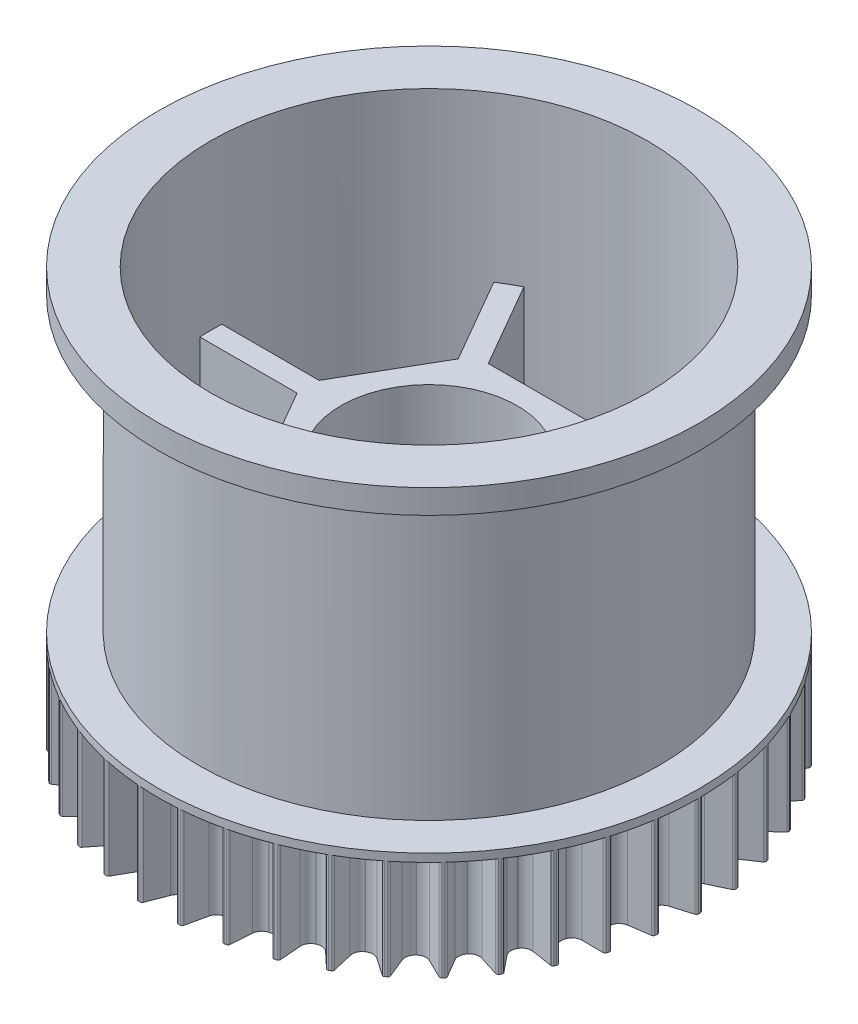
from build123d import *

# Parameters (mm, degrees)
SKETCH_1_R          = 4.4
EXTRUDE_1_DEPTH     = 5
SKETCH_2_R          = 13.5
SKETCH_2_R_2        = 11.2
EXTRUDE_2_DEPTH     = 0.4
SKETCH_2_2_R        = 11.5
SKETCH_2_2_R_2      = 10.9
EXTRUDE_2_2_DEPTH   = 15
SKETCH_5_R          = 13.5
SKETCH_5_R_2        = 10.9
EXTRUDE_3_DEPTH     = 1.2
SKETCH_6_R          = 4.4
EXTRUDE_4_DEPTH     = 8
SKETCH_1_6_R        = 4.4
SKETCH_1_6_R_2      = 3.5
EXTRUDE_5_DEPTH     = 13
SKETCH_1_7_R        = 4.4
SKETCH_1_7_R_2      = 3.5
CUT_EXTRUDE_1_DEPTH = 3
CUT_EXTRUDE_START   = -3
SKETCH_8_R          = 4.4
SKETCH_8_R_2        = 3.5
CUT_EXTRUDE_2_DEPTH = 3


with BuildPart() as part:
    # 草图1 → 凸台-拉伸1 (new body)
    with BuildSketch(Plane(origin=(0, 0, 0), x_dir=(1, 0, 0), z_dir=(0, 1, 0))):
        with BuildLine():
            Line((12.421648835, 0.449416948), (13.428727986, 0.146279171))
            ThreePointArc((13.428727986, 0.146279171), (13.480048996, 0.110330314), (13.499904043, 0.050900158))
            ThreePointArc((13.499904043, 0.050900158), (13.5, 0), (13.499904043, -0.050900158))
            ThreePointArc((13.499904043, -0.050900158), (13.480048996, -0.110330314), (13.428727986, -0.146279171))
            Line((13.428727986, -0.146279171), (12.421648835, -0.449416948))
            ThreePointArc((12.421648835, -0.449416948), (12.175747513, -0.615329239), (12.067123529, -0.89136398))
            ThreePointArc((12.067123529, -0.89136398), (12.066165946, -0.904234132), (12.065194637, -0.917103256))
            ThreePointArc((12.065194637, -0.917103256), (12.131464538, -1.206244482), (12.349891401, -1.40695336))
            Line((12.349891401, -1.40695336), (13.300541969, -1.856802698))
            ThreePointArc((13.300541969, -1.856802698), (13.345931866, -1.899999035), (13.356707544, -1.961724646))
            ThreePointArc((13.356707544, -1.961724646), (13.349216154, -2.012070593), (13.341534994, -2.062387937))
            ThreePointArc((13.341534994, -2.062387937), (13.313044106, -2.118195066), (13.256938411, -2.146093404))
            Line((13.256938411, -2.146093404), (12.21592716, -2.295748024))
            ThreePointArc((12.21592716, -2.295748024), (11.948044409, -2.423157522), (11.799492821, -2.679919618))
            ThreePointArc((11.799492821, -2.679919618), (11.796627737, -2.692503301), (11.793749233, -2.705083921))
            ThreePointArc((11.793749233, -2.705083921), (11.816184691, -3.000872694), (12.0022578, -3.231894655))
            Line((12.0022578, -3.231894655), (12.875243823, -3.818406662))
            ThreePointArc((12.875243823, -3.818406662), (12.913688672, -3.867885545), (12.915144269, -3.930527764))
            ThreePointArc((12.915144269, -3.930527764), (12.900232878, -3.979194855), (12.885138099, -4.027805378))
            ThreePointArc((12.885138099, -4.027805378), (12.84864781, -4.07874284), (12.789010738, -4.097967457))
            Line((12.789010738, -4.097967457), (11.737321858, -4.090795883))
            ThreePointArc((11.737321858, -4.090795883), (11.453441736, -4.176856469), (11.268280943, -4.40861028))
            ThreePointArc((11.268280943, -4.40861028), (11.263572359, -4.420626395), (11.258850961, -4.432637481))
            ThreePointArc((11.258850961, -4.432637481), (11.236950804, -4.72846637), (11.386513594, -4.984640763))
            Line((11.386513594, -4.984640763), (12.162334005, -5.694713732))
            ThreePointArc((12.162334005, -5.694713732), (12.192975012, -5.749369884), (12.185078013, -5.811529386))
            ThreePointArc((12.185078013, -5.811529386), (12.163079717, -5.857430478), (12.140908512, -5.903248302))
            ThreePointArc((12.140908512, -5.903248302), (12.097233954, -5.94817824), (12.035397698, -5.958299689))
            Line((12.035397698, -5.958299689), (10.996524182, -5.794462121))
            ThreePointArc((10.996524182, -5.794462121), (10.702988102, -5.837251346), (10.485354288, -6.038819873))
            ThreePointArc((10.485354288, -6.038819873), (10.478907386, -6.05), (10.472448563, -6.061173244))
            ThreePointArc((10.472448563, -6.061173244), (10.406702004, -6.35043392), (10.51641349, -6.626038234))
            Line((10.51641349, -6.626038234), (11.177737743, -7.443810306))
            ThreePointArc((11.177737743, -7.443810306), (11.199890439, -7.5024228), (11.18281725, -7.562711045))
            ThreePointArc((11.18281725, -7.562711045), (11.154223453, -7.604820784), (11.12547109, -7.646822414))
            ThreePointArc((11.12547109, -7.646822414), (11.075587881, -7.684741166), (11.012933761, -7.685533352))
            Line((11.012933761, -7.685533352), (10.010082327, -7.368689651))
            ThreePointArc((10.010082327, -7.368689651), (9.713447399, -7.367251672), (9.468202145, -7.534132209))
            ThreePointArc((9.468202145, -7.534132209), (9.460160938, -7.544226602), (9.452108969, -7.554312413))
            ThreePointArc((9.452108969, -7.554312413), (9.343984679, -7.83054327), (9.411394086, -8.11942096))
            Line((9.411394086, -8.11942096), (9.943449291, -9.026624459))
            ThreePointArc((9.943449291, -9.026624459), (9.956618821, -9.087883988), (9.930750828, -9.144954237))
            ThreePointArc((9.930750828, -9.144954237), (9.89620027, -9.18233196), (9.861509029, -9.219579149))
            ThreePointArc((9.861509029, -9.219579149), (9.806531477, -9.249639674), (9.744459083, -9.241084899))
            Line((9.744459083, -9.241084899), (8.800031773, -8.778312831))
            ThreePointArc((8.800031773, -8.778312831), (8.506924332, -8.732679771), (8.239546012, -8.861144482))
            ThreePointArc((8.239546012, -8.861144482), (8.230090127, -8.869927649), (8.22062488, -8.878700726))
            ThreePointArc((8.22062488, -8.878700726), (8.072538176, -9.135731223), (8.09613969, -9.431429239))
            Line((8.09613969, -9.431429239), (8.487040612, -10.407798738))
            ThreePointArc((8.487040612, -10.407798738), (8.49093279, -10.470336865), (8.456847843, -10.522914262))
            ThreePointArc((8.456847843, -10.522914262), (8.417112325, -10.554725013), (8.377257151, -10.586385721))
            ThreePointArc((8.377257151, -10.586385721), (8.318413365, -10.607916516), (8.258309291, -10.59020588))
            Line((8.258309291, -10.59020588), (7.393403052, -9.991843007))
            ThreePointArc((7.393403052, -9.991843007), (7.110370633, -9.903034234), (6.826832036, -9.990213429))
            ThreePointArc((6.826832036, -9.990213429), (6.816172703, -9.997489169), (6.805505615, -10.004753536))
            ThreePointArc((6.805505615, -10.004753536), (6.620764509, -10.236842037), (6.600030911, -10.532754974))
            Line((6.600030911, -10.532754974), (6.841045471, -11.556479991))
            ThreePointArc((6.841045471, -11.556479991), (6.835573353, -11.618899718), (6.794032851, -11.665809771))
            ThreePointArc((6.794032851, -11.665809771), (6.75, -11.691342951), (6.705871192, -11.716709929))
            ThreePointArc((6.705871192, -11.716709929), (6.644475643, -11.729230032), (6.587682515, -11.702759162))
            Line((6.587682515, -11.702759162), (5.821617923, -10.982171922))
            ThreePointArc((5.821617923, -10.982171922), (5.554983004, -10.852171276), (5.261617913, -10.896117516))
            ThreePointArc((5.261617913, -10.896117516), (5.249993243, -10.901723302), (5.238362601, -10.907316685))
            ThreePointArc((5.238362601, -10.907316685), (5.021093904, -11.109278715), (4.956488349, -11.398796367))
            Line((4.956488349, -11.398796367), (5.042232678, -12.447008578))
            ThreePointArc((5.042232678, -12.447008578), (5.027518502, -12.507915551), (4.979450393, -12.548110367))
            ThreePointArc((4.979450393, -12.548110367), (4.932103829, -12.566795607), (4.884687151, -12.585302199))
            ThreePointArc((4.884687151, -12.585302199), (4.822111316, -12.588531931), (4.769897799, -12.553892142))
            Line((4.769897799, -12.553892142), (4.11978747, -11.727177263))
            ThreePointArc((4.11978747, -11.727177263), (3.875506233, -11.558888745), (3.578867941, -11.558620344))
            ThreePointArc((3.578867941, -11.558620344), (3.56653761, -11.56243095), (3.554203222, -11.566228402))
            ThreePointArc((3.554203222, -11.566228402), (3.309260359, -11.733552465), (3.202226027, -12.010207485))
            Line((3.202226027, -12.010207485), (3.13078474, -13.059491561))
            ThreePointArc((3.13078474, -13.059491561), (3.107157195, -13.117525219), (3.053635241, -13.150106913))
            ThreePointArc((3.053635241, -13.150106913), (3.004032608, -13.161526814), (2.954387271, -13.172759614))
            ThreePointArc((2.954387271, -13.172759614), (2.89202899, -13.166626828), (2.845561447, -13.124591917))
            Line((2.845561447, -13.124591917), (2.325927773, -12.210216843))
            ThreePointArc((2.325927773, -12.210216843), (2.109457058, -12.007399739), (1.816171974, -11.962922693))
            ThreePointArc((1.816171974, -11.962922693), (1.803411421, -11.964852997), (1.790648816, -11.96676969))
            ThreePointArc((1.790648816, -11.96676969), (1.523503405, -12.095718042), (1.376431267, -12.353330415))
            Line((1.376431267, -12.353330415), (1.149400244, -13.380247083))
            ThreePointArc((1.149400244, -13.380247083), (1.117387131, -13.43411105), (1.059606923, -13.4583518))
            ThreePointArc((1.059606923, -13.4583518), (1.008856263, -13.462251262), (0.958091262, -13.465959347))
            ThreePointArc((0.958091262, -13.465959347), (0.897343515, -13.45060104), (0.857659955, -13.402109995))
            Line((0.857659955, -13.402109995), (0.480110693, -12.420500356))
            ThreePointArc((0.480110693, -12.420500356), (0.296286097, -12.187685265), (0.012905725, -12.099993117))
            ThreePointArc((0.012905725, -12.099993117), (0, -12.1), (-0.012905725, -12.099993117))
            ThreePointArc((-0.012905725, -12.099993117), (-0.296286097, -12.187685265), (-0.480110693, -12.420500356))
            Line((-0.480110693, -12.420500356), (-0.857659955, -13.402109995))
            ThreePointArc((-0.857659955, -13.402109995), (-0.897343515, -13.45060104), (-0.958091262, -13.465959347))
            ThreePointArc((-0.958091262, -13.465959347), (-1.008856263, -13.462251262), (-1.059606923, -13.4583518))
            ThreePointArc((-1.059606923, -13.4583518), (-1.117387131, -13.43411105), (-1.149400244, -13.380247083))
            Line((-1.149400244, -13.380247083), (-1.376431267, -12.353330415))
            ThreePointArc((-1.376431267, -12.353330415), (-1.523503405, -12.095718042), (-1.790648816, -11.96676969))
            ThreePointArc((-1.790648816, -11.96676969), (-1.803411421, -11.964852997), (-1.816171974, -11.962922693))
            ThreePointArc((-1.816171974, -11.962922693), (-2.109457058, -12.007399739), (-2.325927773, -12.210216843))
            Line((-2.325927773, -12.210216843), (-2.845561447, -13.124591917))
            ThreePointArc((-2.845561447, -13.124591917), (-2.89202899, -13.166626828), (-2.954387271, -13.172759614))
            ThreePointArc((-2.954387271, -13.172759614), (-3.004032608, -13.161526814), (-3.053635241, -13.150106913))
            ThreePointArc((-3.053635241, -13.150106913), (-3.107157195, -13.117525219), (-3.13078474, -13.059491561))
            Line((-3.13078474, -13.059491561), (-3.202226027, -12.010207485))
            ThreePointArc((-3.202226027, -12.010207485), (-3.309260359, -11.733552465), (-3.554203222, -11.566228402))
            ThreePointArc((-3.554203222, -11.566228402), (-3.56653761, -11.56243095), (-3.578867941, -11.558620344))
            ThreePointArc((-3.578867941, -11.558620344), (-3.875506233, -11.558888745), (-4.11978747, -11.727177263))
            Line((-4.11978747, -11.727177263), (-4.769897799, -12.553892142))
            ThreePointArc((-4.769897799, -12.553892142), (-4.822111316, -12.588531931), (-4.884687151, -12.585302199))
            ThreePointArc((-4.884687151, -12.585302199), (-4.932103829, -12.566795607), (-4.979450393, -12.548110367))
            ThreePointArc((-4.979450393, -12.548110367), (-5.027518502, -12.507915551), (-5.042232678, -12.447008578))
            Line((-5.042232678, -12.447008578), (-4.956488349, -11.398796367))
            ThreePointArc((-4.956488349, -11.398796367), (-5.021093904, -11.109278715), (-5.238362601, -10.907316685))
            ThreePointArc((-5.238362601, -10.907316685), (-5.249993243, -10.901723302), (-5.261617913, -10.896117516))
            ThreePointArc((-5.261617913, -10.896117516), (-5.554983004, -10.852171276), (-5.821617923, -10.982171922))
            Line((-5.821617923, -10.982171922), (-6.587682515, -11.702759162))
            ThreePointArc((-6.587682515, -11.702759162), (-6.644475643, -11.729230032), (-6.705871192, -11.716709929))
            ThreePointArc((-6.705871192, -11.716709929), (-6.75, -11.691342951), (-6.794032851, -11.665809771))
            ThreePointArc((-6.794032851, -11.665809771), (-6.835573353, -11.618899718), (-6.841045471, -11.556479991))
            Line((-6.841045471, -11.556479991), (-6.600030911, -10.532754974))
            ThreePointArc((-6.600030911, -10.532754974), (-6.620764509, -10.236842037), (-6.805505615, -10.004753536))
            ThreePointArc((-6.805505615, -10.004753536), (-6.816172703, -9.997489169), (-6.826832036, -9.990213429))
            ThreePointArc((-6.826832036, -9.990213429), (-7.110370633, -9.903034234), (-7.393403052, -9.991843007))
            Line((-7.393403052, -9.991843007), (-8.258309291, -10.59020588))
            ThreePointArc((-8.258309291, -10.59020588), (-8.318413365, -10.607916516), (-8.377257151, -10.586385721))
            ThreePointArc((-8.377257151, -10.586385721), (-8.417112325, -10.554725013), (-8.456847843, -10.522914262))
            ThreePointArc((-8.456847843, -10.522914262), (-8.49093279, -10.470336865), (-8.487040612, -10.407798738))
            Line((-8.487040612, -10.407798738), (-8.09613969, -9.431429239))
            ThreePointArc((-8.09613969, -9.431429239), (-8.072538176, -9.135731223), (-8.22062488, -8.878700726))
            ThreePointArc((-8.22062488, -8.878700726), (-8.230090127, -8.869927649), (-8.239546012, -8.861144482))
            ThreePointArc((-8.239546012, -8.861144482), (-8.506924332, -8.732679771), (-8.800031773, -8.778312831))
            Line((-8.800031773, -8.778312831), (-9.744459083, -9.241084899))
            ThreePointArc((-9.744459083, -9.241084899), (-9.806531477, -9.249639674), (-9.861509029, -9.219579149))
            ThreePointArc((-9.861509029, -9.219579149), (-9.89620027, -9.18233196), (-9.930750828, -9.144954237))
            ThreePointArc((-9.930750828, -9.144954237), (-9.956618821, -9.087883988), (-9.943449291, -9.026624459))
            Line((-9.943449291, -9.026624459), (-9.411394086, -8.11942096))
            ThreePointArc((-9.411394086, -8.11942096), (-9.343984679, -7.83054327), (-9.452108969, -7.554312413))
            ThreePointArc((-9.452108969, -7.554312413), (-9.460160938, -7.544226602), (-9.468202145, -7.534132209))
            ThreePointArc((-9.468202145, -7.534132209), (-9.713447399, -7.367251672), (-10.010082327, -7.368689651))
            Line((-10.010082327, -7.368689651), (-11.012933761, -7.685533352))
            ThreePointArc((-11.012933761, -7.685533352), (-11.075587881, -7.684741166), (-11.12547109, -7.646822414))
            ThreePointArc((-11.12547109, -7.646822414), (-11.154223453, -7.604820784), (-11.18281725, -7.562711045))
            ThreePointArc((-11.18281725, -7.562711045), (-11.199890439, -7.5024228), (-11.177737743, -7.443810306))
            Line((-11.177737743, -7.443810306), (-10.51641349, -6.626038234))
            ThreePointArc((-10.51641349, -6.626038234), (-10.406702004, -6.35043392), (-10.472448563, -6.061173244))
            ThreePointArc((-10.472448563, -6.061173244), (-10.478907386, -6.05), (-10.485354288, -6.038819873))
            ThreePointArc((-10.485354288, -6.038819873), (-10.702988102, -5.837251346), (-10.996524182, -5.794462121))
            Line((-10.996524182, -5.794462121), (-12.035397698, -5.958299689))
            ThreePointArc((-12.035397698, -5.958299689), (-12.097233954, -5.94817824), (-12.140908512, -5.903248302))
            ThreePointArc((-12.140908512, -5.903248302), (-12.163079717, -5.857430478), (-12.185078013, -5.811529386))
            ThreePointArc((-12.185078013, -5.811529386), (-12.192975012, -5.749369884), (-12.162334005, -5.694713732))
            Line((-12.162334005, -5.694713732), (-11.386513594, -4.984640763))
            ThreePointArc((-11.386513594, -4.984640763), (-11.236950804, -4.72846637), (-11.258850961, -4.432637481))
            ThreePointArc((-11.258850961, -4.432637481), (-11.263572359, -4.420626395), (-11.268280943, -4.40861028))
            ThreePointArc((-11.268280943, -4.40861028), (-11.453441736, -4.176856469), (-11.737321858, -4.090795883))
            Line((-11.737321858, -4.090795883), (-12.789010738, -4.097967457))
            ThreePointArc((-12.789010738, -4.097967457), (-12.84864781, -4.07874284), (-12.885138099, -4.027805378))
            ThreePointArc((-12.885138099, -4.027805378), (-12.900232878, -3.979194855), (-12.915144269, -3.930527764))
            ThreePointArc((-12.915144269, -3.930527764), (-12.913688672, -3.867885545), (-12.875243823, -3.818406662))
            Line((-12.875243823, -3.818406662), (-12.0022578, -3.231894655))
            ThreePointArc((-12.0022578, -3.231894655), (-11.816184691, -3.000872694), (-11.793749233, -2.705083921))
            ThreePointArc((-11.793749233, -2.705083921), (-11.796627737, -2.692503301), (-11.799492821, -2.679919618))
            ThreePointArc((-11.799492821, -2.679919618), (-11.948044409, -2.423157522), (-12.21592716, -2.295748024))
            Line((-12.21592716, -2.295748024), (-13.256938411, -2.146093404))
            ThreePointArc((-13.256938411, -2.146093404), (-13.313044106, -2.118195066), (-13.341534994, -2.062387937))
            ThreePointArc((-13.341534994, -2.062387937), (-13.349216154, -2.012070593), (-13.356707544, -1.961724646))
            ThreePointArc((-13.356707544, -1.961724646), (-13.345931866, -1.899999035), (-13.300541969, -1.856802698))
            Line((-13.300541969, -1.856802698), (-12.349891401, -1.40695336))
            ThreePointArc((-12.349891401, -1.40695336), (-12.131464538, -1.206244482), (-12.065194637, -0.917103256))
            ThreePointArc((-12.065194637, -0.917103256), (-12.066165946, -0.904234132), (-12.067123529, -0.89136398))
            ThreePointArc((-12.067123529, -0.89136398), (-12.175747513, -0.615329239), (-12.421648835, -0.449416948))
            Line((-12.421648835, -0.449416948), (-13.428727986, -0.146279171))
            ThreePointArc((-13.428727986, -0.146279171), (-13.480048996, -0.110330314), (-13.499904043, -0.050900158))
            ThreePointArc((-13.499904043, -0.050900158), (-13.5, 0), (-13.499904043, 0.050900158))
            ThreePointArc((-13.499904043, 0.050900158), (-13.480048996, 0.110330314), (-13.428727986, 0.146279171))
            Line((-13.428727986, 0.146279171), (-12.421648835, 0.449416948))
            ThreePointArc((-12.421648835, 0.449416948), (-12.175747513, 0.615329239), (-12.067123529, 0.89136398))
            ThreePointArc((-12.067123529, 0.89136398), (-12.066165946, 0.904234132), (-12.065194637, 0.917103256))
            ThreePointArc((-12.065194637, 0.917103256), (-12.131464538, 1.206244482), (-12.349891401, 1.40695336))
            Line((-12.349891401, 1.40695336), (-13.300541969, 1.856802698))
            ThreePointArc((-13.300541969, 1.856802698), (-13.345931866, 1.899999035), (-13.356707544, 1.961724646))
            ThreePointArc((-13.356707544, 1.961724646), (-13.349216154, 2.012070593), (-13.341534994, 2.062387937))
            ThreePointArc((-13.341534994, 2.062387937), (-13.313044106, 2.118195066), (-13.256938411, 2.146093404))
            Line((-13.256938411, 2.146093404), (-12.21592716, 2.295748024))
            ThreePointArc((-12.21592716, 2.295748024), (-11.948044409, 2.423157522), (-11.799492821, 2.679919618))
            ThreePointArc((-11.799492821, 2.679919618), (-11.796627737, 2.692503301), (-11.793749233, 2.705083921))
            ThreePointArc((-11.793749233, 2.705083921), (-11.816184691, 3.000872694), (-12.0022578, 3.231894655))
            Line((-12.0022578, 3.231894655), (-12.875243823, 3.818406662))
            ThreePointArc((-12.875243823, 3.818406662), (-12.913688672, 3.867885545), (-12.915144269, 3.930527764))
            ThreePointArc((-12.915144269, 3.930527764), (-12.900232878, 3.979194855), (-12.885138099, 4.027805378))
            ThreePointArc((-12.885138099, 4.027805378), (-12.84864781, 4.07874284), (-12.789010738, 4.097967457))
            Line((-12.789010738, 4.097967457), (-11.737321858, 4.090795883))
            ThreePointArc((-11.737321858, 4.090795883), (-11.453441736, 4.176856469), (-11.268280943, 4.40861028))
            ThreePointArc((-11.268280943, 4.40861028), (-11.263572359, 4.420626395), (-11.258850961, 4.432637481))
            ThreePointArc((-11.258850961, 4.432637481), (-11.236950804, 4.72846637), (-11.386513594, 4.984640763))
            Line((-11.386513594, 4.984640763), (-12.162334005, 5.694713732))
            ThreePointArc((-12.162334005, 5.694713732), (-12.192975012, 5.749369884), (-12.185078013, 5.811529386))
            ThreePointArc((-12.185078013, 5.811529386), (-12.163079717, 5.857430478), (-12.140908512, 5.903248302))
            ThreePointArc((-12.140908512, 5.903248302), (-12.097233954, 5.94817824), (-12.035397698, 5.958299689))
            Line((-12.035397698, 5.958299689), (-10.996524182, 5.794462121))
            ThreePointArc((-10.996524182, 5.794462121), (-10.702988102, 5.837251346), (-10.485354288, 6.038819873))
            ThreePointArc((-10.485354288, 6.038819873), (-10.478907386, 6.05), (-10.472448563, 6.061173244))
            ThreePointArc((-10.472448563, 6.061173244), (-10.406702004, 6.35043392), (-10.51641349, 6.626038234))
            Line((-10.51641349, 6.626038234), (-11.177737743, 7.443810306))
            ThreePointArc((-11.177737743, 7.443810306), (-11.199890439, 7.5024228), (-11.18281725, 7.562711045))
            ThreePointArc((-11.18281725, 7.562711045), (-11.154223453, 7.604820784), (-11.12547109, 7.646822414))
            ThreePointArc((-11.12547109, 7.646822414), (-11.075587881, 7.684741166), (-11.012933761, 7.685533352))
            Line((-11.012933761, 7.685533352), (-10.010082327, 7.368689651))
            ThreePointArc((-10.010082327, 7.368689651), (-9.713447399, 7.367251672), (-9.468202145, 7.534132209))
            ThreePointArc((-9.468202145, 7.534132209), (-9.460160938, 7.544226602), (-9.452108969, 7.554312413))
            ThreePointArc((-9.452108969, 7.554312413), (-9.343984679, 7.83054327), (-9.411394086, 8.11942096))
            Line((-9.411394086, 8.11942096), (-9.943449291, 9.026624459))
            ThreePointArc((-9.943449291, 9.026624459), (-9.956618821, 9.087883988), (-9.930750828, 9.144954237))
            ThreePointArc((-9.930750828, 9.144954237), (-9.89620027, 9.18233196), (-9.861509029, 9.219579149))
            ThreePointArc((-9.861509029, 9.219579149), (-9.806531477, 9.249639674), (-9.744459083, 9.241084899))
            Line((-9.744459083, 9.241084899), (-8.800031773, 8.778312831))
            ThreePointArc((-8.800031773, 8.778312831), (-8.506924332, 8.732679771), (-8.239546012, 8.861144482))
            ThreePointArc((-8.239546012, 8.861144482), (-8.230090127, 8.869927649), (-8.22062488, 8.878700726))
            ThreePointArc((-8.22062488, 8.878700726), (-8.072538176, 9.135731223), (-8.09613969, 9.431429239))
            Line((-8.09613969, 9.431429239), (-8.487040612, 10.407798738))
            ThreePointArc((-8.487040612, 10.407798738), (-8.49093279, 10.470336865), (-8.456847843, 10.522914262))
            ThreePointArc((-8.456847843, 10.522914262), (-8.417112325, 10.554725013), (-8.377257151, 10.586385721))
            ThreePointArc((-8.377257151, 10.586385721), (-8.318413365, 10.607916516), (-8.258309291, 10.59020588))
            Line((-8.258309291, 10.59020588), (-7.393403052, 9.991843007))
            ThreePointArc((-7.393403052, 9.991843007), (-7.110370633, 9.903034234), (-6.826832036, 9.990213429))
            ThreePointArc((-6.826832036, 9.990213429), (-6.816172703, 9.997489169), (-6.805505615, 10.004753536))
            ThreePointArc((-6.805505615, 10.004753536), (-6.620764509, 10.236842037), (-6.600030911, 10.532754974))
            Line((-6.600030911, 10.532754974), (-6.841045471, 11.556479991))
            ThreePointArc((-6.841045471, 11.556479991), (-6.835573353, 11.618899718), (-6.794032851, 11.665809771))
            ThreePointArc((-6.794032851, 11.665809771), (-6.75, 11.691342951), (-6.705871192, 11.716709929))
            ThreePointArc((-6.705871192, 11.716709929), (-6.644475643, 11.729230032), (-6.587682515, 11.702759162))
            Line((-6.587682515, 11.702759162), (-5.821617923, 10.982171922))
            ThreePointArc((-5.821617923, 10.982171922), (-5.554983004, 10.852171276), (-5.261617913, 10.896117516))
            ThreePointArc((-5.261617913, 10.896117516), (-5.249993243, 10.901723302), (-5.238362601, 10.907316685))
            ThreePointArc((-5.238362601, 10.907316685), (-5.021093904, 11.109278715), (-4.956488349, 11.398796367))
            Line((-4.956488349, 11.398796367), (-5.042232678, 12.447008578))
            ThreePointArc((-5.042232678, 12.447008578), (-5.027518502, 12.507915551), (-4.979450393, 12.548110367))
            ThreePointArc((-4.979450393, 12.548110367), (-4.932103829, 12.566795607), (-4.884687151, 12.585302199))
            ThreePointArc((-4.884687151, 12.585302199), (-4.822111316, 12.588531931), (-4.769897799, 12.553892142))
            Line((-4.769897799, 12.553892142), (-4.11978747, 11.727177263))
            ThreePointArc((-4.11978747, 11.727177263), (-3.875506233, 11.558888745), (-3.578867941, 11.558620344))
            ThreePointArc((-3.578867941, 11.558620344), (-3.56653761, 11.56243095), (-3.554203222, 11.566228402))
            ThreePointArc((-3.554203222, 11.566228402), (-3.309260359, 11.733552465), (-3.202226027, 12.010207485))
            Line((-3.202226027, 12.010207485), (-3.13078474, 13.059491561))
            ThreePointArc((-3.13078474, 13.059491561), (-3.107157195, 13.117525219), (-3.053635241, 13.150106913))
            ThreePointArc((-3.053635241, 13.150106913), (-3.004032608, 13.161526814), (-2.954387271, 13.172759614))
            ThreePointArc((-2.954387271, 13.172759614), (-2.89202899, 13.166626828), (-2.845561447, 13.124591917))
            Line((-2.845561447, 13.124591917), (-2.325927773, 12.210216843))
            ThreePointArc((-2.325927773, 12.210216843), (-2.109457058, 12.007399739), (-1.816171974, 11.962922693))
            ThreePointArc((-1.816171974, 11.962922693), (-1.803411421, 11.964852997), (-1.790648816, 11.96676969))
            ThreePointArc((-1.790648816, 11.96676969), (-1.523503405, 12.095718042), (-1.376431267, 12.353330415))
            Line((-1.376431267, 12.353330415), (-1.149400244, 13.380247083))
            ThreePointArc((-1.149400244, 13.380247083), (-1.117387131, 13.43411105), (-1.059606923, 13.4583518))
            ThreePointArc((-1.059606923, 13.4583518), (-1.008856263, 13.462251262), (-0.958091262, 13.465959347))
            ThreePointArc((-0.958091262, 13.465959347), (-0.897343515, 13.45060104), (-0.857659955, 13.402109995))
            Line((-0.857659955, 13.402109995), (-0.480110693, 12.420500356))
            ThreePointArc((-0.480110693, 12.420500356), (-0.296286097, 12.187685265), (-0.012905725, 12.099993117))
            ThreePointArc((-0.012905725, 12.099993117), (0, 12.1), (0.012905725, 12.099993117))
            ThreePointArc((0.012905725, 12.099993117), (0.296286097, 12.187685265), (0.480110693, 12.420500356))
            Line((0.480110693, 12.420500356), (0.857659955, 13.402109995))
            ThreePointArc((0.857659955, 13.402109995), (0.897343515, 13.45060104), (0.958091262, 13.465959347))
            ThreePointArc((0.958091262, 13.465959347), (1.008856263, 13.462251262), (1.059606923, 13.4583518))
            ThreePointArc((1.059606923, 13.4583518), (1.117387131, 13.43411105), (1.149400244, 13.380247083))
            Line((1.149400244, 13.380247083), (1.376431267, 12.353330415))
            ThreePointArc((1.376431267, 12.353330415), (1.523503405, 12.095718042), (1.790648816, 11.96676969))
            ThreePointArc((1.790648816, 11.96676969), (1.803411421, 11.964852997), (1.816171974, 11.962922693))
            ThreePointArc((1.816171974, 11.962922693), (2.109457058, 12.007399739), (2.325927773, 12.210216843))
            Line((2.325927773, 12.210216843), (2.845561447, 13.124591917))
            ThreePointArc((2.845561447, 13.124591917), (2.89202899, 13.166626828), (2.954387271, 13.172759614))
            ThreePointArc((2.954387271, 13.172759614), (3.004032608, 13.161526814), (3.053635241, 13.150106913))
            ThreePointArc((3.053635241, 13.150106913), (3.107157195, 13.117525219), (3.13078474, 13.059491561))
            Line((3.13078474, 13.059491561), (3.202226027, 12.010207485))
            ThreePointArc((3.202226027, 12.010207485), (3.309260359, 11.733552465), (3.554203222, 11.566228402))
            ThreePointArc((3.554203222, 11.566228402), (3.56653761, 11.56243095), (3.578867941, 11.558620344))
            ThreePointArc((3.578867941, 11.558620344), (3.875506233, 11.558888745), (4.11978747, 11.727177263))
            Line((4.11978747, 11.727177263), (4.769897799, 12.553892142))
            ThreePointArc((4.769897799, 12.553892142), (4.822111316, 12.588531931), (4.884687151, 12.585302199))
            ThreePointArc((4.884687151, 12.585302199), (4.932103829, 12.566795607), (4.979450393, 12.548110367))
            ThreePointArc((4.979450393, 12.548110367), (5.027518502, 12.507915551), (5.042232678, 12.447008578))
            Line((5.042232678, 12.447008578), (4.956488349, 11.398796367))
            ThreePointArc((4.956488349, 11.398796367), (5.021093904, 11.109278715), (5.238362601, 10.907316685))
            ThreePointArc((5.238362601, 10.907316685), (5.249993243, 10.901723302), (5.261617913, 10.896117516))
            ThreePointArc((5.261617913, 10.896117516), (5.554983004, 10.852171276), (5.821617923, 10.982171922))
            Line((5.821617923, 10.982171922), (6.587682515, 11.702759162))
            ThreePointArc((6.587682515, 11.702759162), (6.644475643, 11.729230032), (6.705871192, 11.716709929))
            ThreePointArc((6.705871192, 11.716709929), (6.75, 11.691342951), (6.794032851, 11.665809771))
            ThreePointArc((6.794032851, 11.665809771), (6.835573353, 11.618899718), (6.841045471, 11.556479991))
            Line((6.841045471, 11.556479991), (6.600030911, 10.532754974))
            ThreePointArc((6.600030911, 10.532754974), (6.620764509, 10.236842037), (6.805505615, 10.004753536))
            ThreePointArc((6.805505615, 10.004753536), (6.816172703, 9.997489169), (6.826832036, 9.990213429))
            ThreePointArc((6.826832036, 9.990213429), (7.110370633, 9.903034234), (7.393403052, 9.991843007))
            Line((7.393403052, 9.991843007), (8.258309291, 10.59020588))
            ThreePointArc((8.258309291, 10.59020588), (8.318413365, 10.607916516), (8.377257151, 10.586385721))
            ThreePointArc((8.377257151, 10.586385721), (8.417112325, 10.554725013), (8.456847843, 10.522914262))
            ThreePointArc((8.456847843, 10.522914262), (8.49093279, 10.470336865), (8.487040612, 10.407798738))
            Line((8.487040612, 10.407798738), (8.09613969, 9.431429239))
            ThreePointArc((8.09613969, 9.431429239), (8.072538176, 9.135731223), (8.22062488, 8.878700726))
            ThreePointArc((8.22062488, 8.878700726), (8.230090127, 8.869927649), (8.239546012, 8.861144482))
            ThreePointArc((8.239546012, 8.861144482), (8.506924332, 8.732679771), (8.800031773, 8.778312831))
            Line((8.800031773, 8.778312831), (9.744459083, 9.241084899))
            ThreePointArc((9.744459083, 9.241084899), (9.806531477, 9.249639674), (9.861509029, 9.219579149))
            ThreePointArc((9.861509029, 9.219579149), (9.89620027, 9.18233196), (9.930750828, 9.144954237))
            ThreePointArc((9.930750828, 9.144954237), (9.956618821, 9.087883988), (9.943449291, 9.026624459))
            Line((9.943449291, 9.026624459), (9.411394086, 8.11942096))
            ThreePointArc((9.411394086, 8.11942096), (9.343984679, 7.83054327), (9.452108969, 7.554312413))
            ThreePointArc((9.452108969, 7.554312413), (9.460160938, 7.544226602), (9.468202145, 7.534132209))
            ThreePointArc((9.468202145, 7.534132209), (9.713447399, 7.367251672), (10.010082327, 7.368689651))
            Line((10.010082327, 7.368689651), (11.012933761, 7.685533352))
            ThreePointArc((11.012933761, 7.685533352), (11.075587881, 7.684741166), (11.12547109, 7.646822414))
            ThreePointArc((11.12547109, 7.646822414), (11.154223453, 7.604820784), (11.18281725, 7.562711045))
            ThreePointArc((11.18281725, 7.562711045), (11.199890439, 7.5024228), (11.177737743, 7.443810306))
            Line((11.177737743, 7.443810306), (10.51641349, 6.626038234))
            ThreePointArc((10.51641349, 6.626038234), (10.406702004, 6.35043392), (10.472448563, 6.061173244))
            ThreePointArc((10.472448563, 6.061173244), (10.478907386, 6.05), (10.485354288, 6.038819873))
            ThreePointArc((10.485354288, 6.038819873), (10.702988102, 5.837251346), (10.996524182, 5.794462121))
            Line((10.996524182, 5.794462121), (12.035397698, 5.958299689))
            ThreePointArc((12.035397698, 5.958299689), (12.097233954, 5.94817824), (12.140908512, 5.903248302))
            ThreePointArc((12.140908512, 5.903248302), (12.163079717, 5.857430478), (12.185078013, 5.811529386))
            ThreePointArc((12.185078013, 5.811529386), (12.192975012, 5.749369884), (12.162334005, 5.694713732))
            Line((12.162334005, 5.694713732), (11.386513594, 4.984640763))
            ThreePointArc((11.386513594, 4.984640763), (11.236950804, 4.72846637), (11.258850961, 4.432637481))
            ThreePointArc((11.258850961, 4.432637481), (11.263572359, 4.420626395), (11.268280943, 4.40861028))
            ThreePointArc((11.268280943, 4.40861028), (11.453441736, 4.176856469), (11.737321858, 4.090795883))
            Line((11.737321858, 4.090795883), (12.789010738, 4.097967457))
            ThreePointArc((12.789010738, 4.097967457), (12.84864781, 4.07874284), (12.885138099, 4.027805378))
            ThreePointArc((12.885138099, 4.027805378), (12.900232878, 3.979194855), (12.915144269, 3.930527764))
            ThreePointArc((12.915144269, 3.930527764), (12.913688672, 3.867885545), (12.875243823, 3.818406662))
            Line((12.875243823, 3.818406662), (12.0022578, 3.231894655))
            ThreePointArc((12.0022578, 3.231894655), (11.816184691, 3.000872694), (11.793749233, 2.705083921))
            ThreePointArc((11.793749233, 2.705083921), (11.796627737, 2.692503301), (11.799492821, 2.679919618))
            ThreePointArc((11.799492821, 2.679919618), (11.948044409, 2.423157522), (12.21592716, 2.295748024))
            Line((12.21592716, 2.295748024), (13.256938411, 2.146093404))
            ThreePointArc((13.256938411, 2.146093404), (13.313044106, 2.118195066), (13.341534994, 2.062387937))
            ThreePointArc((13.341534994, 2.062387937), (13.349216154, 2.012070593), (13.356707544, 1.961724646))
            ThreePointArc((13.356707544, 1.961724646), (13.345931866, 1.899999035), (13.300541969, 1.856802698))
            Line((13.300541969, 1.856802698), (12.349891401, 1.40695336))
            ThreePointArc((12.349891401, 1.40695336), (12.131464538, 1.206244482), (12.065194637, 0.917103256))
            ThreePointArc((12.065194637, 0.917103256), (12.066165946, 0.904234132), (12.067123529, 0.89136398))
            ThreePointArc((12.067123529, 0.89136398), (12.175747513, 0.615329239), (12.421648835, 0.449416948))
        make_face()
        with Locations(Location((0, 0, 0), (0, 0, 270))):
            Circle(SKETCH_1_R, mode=Mode.SUBTRACT)
        with BuildLine():
            Line((3.492969129, -4.95), (6.033310313, -0.55))
            Line((6.033310313, -0.55), (11.186487384, -0.55))
            ThreePointArc((11.186487384, -0.55), (9.699484522, -5.6), (6.069557664, -9.412782254))
            Line((6.069557664, -9.412782254), (3.492969129, -4.95))
        make_face(mode=Mode.SUBTRACT)
        with BuildLine():
            Line((2.540341184, -5.5), (-2.540341184, -5.5))
            Line((-2.540341184, -5.5), (-5.11692972, -9.962782254))
            ThreePointArc((-5.11692972, -9.962782254), (0, -11.2), (5.11692972, -9.962782254))
            Line((5.11692972, -9.962782254), (2.540341184, -5.5))
        make_face(mode=Mode.SUBTRACT)
        with BuildLine():
            Line((-3.492969129, -4.95), (-6.033310313, -0.55))
            Line((-6.033310313, -0.55), (-11.186487384, -0.55))
            ThreePointArc((-11.186487384, -0.55), (-9.699484522, -5.6), (-6.069557664, -9.412782254))
            Line((-6.069557664, -9.412782254), (-3.492969129, -4.95))
        make_face(mode=Mode.SUBTRACT)
        with BuildLine():
            Line((6.033310313, 0.55), (11.186487384, 0.55))
            ThreePointArc((11.186487384, 0.55), (9.699484522, 5.6), (6.069557664, 9.412782254))
            Line((6.069557664, 9.412782254), (3.492969129, 4.95))
            Line((3.492969129, 4.95), (6.033310313, 0.55))
        make_face(mode=Mode.SUBTRACT)
        with BuildLine():
            Line((-6.033310313, 0.55), (-11.186487384, 0.55))
            ThreePointArc((-11.186487384, 0.55), (-9.699484522, 5.6), (-6.069557664, 9.412782254))
            Line((-6.069557664, 9.412782254), (-3.492969129, 4.95))
            Line((-3.492969129, 4.95), (-6.033310313, 0.55))
        make_face(mode=Mode.SUBTRACT)
        with BuildLine():
            Line((-2.540341184, 5.5), (-5.11692972, 9.962782254))
            ThreePointArc((-5.11692972, 9.962782254), (0, 11.2), (5.11692972, 9.962782254))
            Line((5.11692972, 9.962782254), (2.540341184, 5.5))
            Line((2.540341184, 5.5), (-2.540341184, 5.5))
        make_face(mode=Mode.SUBTRACT)
    extrude(amount=EXTRUDE_1_DEPTH)

    # 草图2 → Extrude 2 (add)
    with BuildSketch(Plane(origin=(0, 5, 0), x_dir=(1, 0, 0), z_dir=(0, 1, 0))):
        with Locations(Location((0, 0, 0), (0, 0, 94.069686794))):
            Circle(SKETCH_2_R)
        with Locations(Location((0, 0, 0), (0, 0, 117.18523589))):
            Circle(SKETCH_2_R_2, mode=Mode.SUBTRACT)
    extrude(amount=EXTRUDE_2_DEPTH)

    # 草图2<2> → Extrude 2 2 (add)
    with BuildSketch(Plane(origin=(0, 5, 0), x_dir=(1, 0, 0), z_dir=(0, 1, 0))):
        Circle(SKETCH_2_2_R)
        Circle(SKETCH_2_2_R_2, mode=Mode.SUBTRACT)
    extrude(amount=EXTRUDE_2_2_DEPTH)

    # 草图5 → 凸台-拉伸3 (add)
    with BuildSketch(Plane(origin=(0, 20, 0), x_dir=(1, 0, 0), z_dir=(0, 1, 0))):
        with Locations(Location((0, 0, 0), (0, 0, 94.069686794))):
            Circle(SKETCH_5_R)
        with Locations(Location((0, 0, 0), (0, 0, 117.107700331))):
            Circle(SKETCH_5_R_2, mode=Mode.SUBTRACT)
    extrude(amount=EXTRUDE_3_DEPTH)

    # 草图6 → 凸台-拉伸4 (add)
    with BuildSketch(Plane(origin=(0, 5, 0), x_dir=(1, 0, 0), z_dir=(0, 1, 0))):
        with BuildLine():
            Line((-4.966743533, -9.702652147), (-2.540341184, -5.5))
            Line((-2.540341184, -5.5), (2.540341184, -5.5))
            Line((2.540341184, -5.5), (4.966743533, -9.702652147))
            ThreePointArc((4.966743533, -9.702652147), (5.45, -9.439676901), (5.919371477, -9.152652147))
            Line((5.919371477, -9.152652147), (3.492969129, -4.95))
            Line((3.492969129, -4.95), (6.033310313, -0.55))
            Line((6.033310313, -0.55), (10.886115009, -0.55))
            ThreePointArc((10.886115009, -0.55), (10.9, 0), (10.886115009, 0.55))
            Line((10.886115009, 0.55), (6.033310313, 0.55))
            Line((6.033310313, 0.55), (3.492969129, 4.95))
            Line((3.492969129, 4.95), (5.919371477, 9.152652147))
            ThreePointArc((5.919371477, 9.152652147), (5.45, 9.439676901), (4.966743533, 9.702652147))
            Line((4.966743533, 9.702652147), (2.540341184, 5.5))
            Line((2.540341184, 5.5), (-2.540341184, 5.5))
            Line((-2.540341184, 5.5), (-4.966743533, 9.702652147))
            ThreePointArc((-4.966743533, 9.702652147), (-5.45, 9.439676901), (-5.919371477, 9.152652147))
            Line((-5.919371477, 9.152652147), (-3.492969129, 4.95))
            Line((-3.492969129, 4.95), (-6.033310313, 0.55))
            Line((-6.033310313, 0.55), (-10.886115009, 0.55))
            ThreePointArc((-10.886115009, 0.55), (-10.9, 0), (-10.886115009, -0.55))
            Line((-10.886115009, -0.55), (-6.033310313, -0.55))
            Line((-6.033310313, -0.55), (-3.492969129, -4.95))
            Line((-3.492969129, -4.95), (-5.919371477, -9.152652147))
            ThreePointArc((-5.919371477, -9.152652147), (-5.45, -9.439676901), (-4.966743533, -9.702652147))
        make_face()
        with Locations(Location((0, 0, 0), (0, 0, 270))):
            Circle(SKETCH_6_R, mode=Mode.SUBTRACT)
    extrude(amount=EXTRUDE_4_DEPTH)

    # 草图1<6> → 凸台-拉伸5 (add)
    with BuildSketch(Plane(origin=(0, 0, 0), x_dir=(1, 0, 0), z_dir=(0, 1, 0))):
        Circle(SKETCH_1_6_R)
        with Locations(Location((0, 0, 0), (0, 0, 270))):
            Circle(SKETCH_1_6_R_2, mode=Mode.SUBTRACT)
    extrude(amount=EXTRUDE_5_DEPTH)

    # 草图1<7> → 切除-拉伸1 (cut)
    with BuildSketch(Plane(origin=(0, 0, 0), x_dir=(1, 0, 0), z_dir=(0, 1, 0))):
        with Locations(Location((0, 0, 0), (0, 0, 270))):
            Circle(SKETCH_1_7_R)
        with Locations(Location((0, 0, 0), (0, 0, 270))):
            Circle(SKETCH_1_7_R_2, mode=Mode.SUBTRACT)
    extrude(amount=CUT_EXTRUDE_1_DEPTH, mode=Mode.SUBTRACT)

    # 草图8 → 切除-拉伸2 (cut)
    with BuildSketch(Plane(origin=(0, 13, 0), x_dir=(1, 0, 0), z_dir=(0, 1, 0)).offset(CUT_EXTRUDE_START)):
        with Locations(Location((0, 0, 0), (0, 0, 270))):
            Circle(SKETCH_8_R)
        with Locations(Location((0, 0, 0), (0, 0, 270))):
            Circle(SKETCH_8_R_2, mode=Mode.SUBTRACT)
    extrude(amount=CUT_EXTRUDE_2_DEPTH, mode=Mode.SUBTRACT)


solid = part.part
